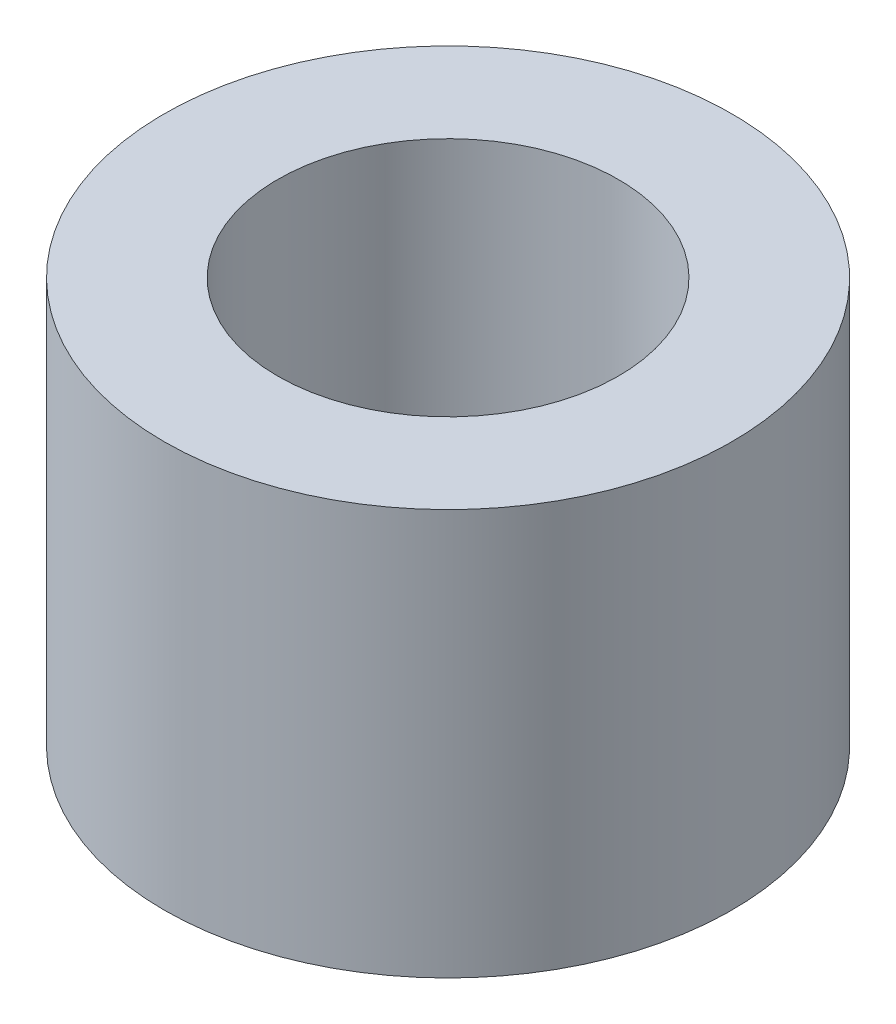
from build123d import *

# Parameters (mm, degrees)
SKETCH_1_R      = 3.5
SKETCH_1_R_2    = 2.1
EXTRUDE_1_DEPTH = 5


with BuildPart() as part:
    # 草图1 → 凸台-拉伸1 (new body)
    with BuildSketch(Plane(origin=(0, 0, 0), x_dir=(1, 0, 0), z_dir=(0, 1, 0))):
        Circle(SKETCH_1_R)
        Circle(SKETCH_1_R_2, mode=Mode.SUBTRACT)
    extrude(amount=EXTRUDE_1_DEPTH)


solid = part.part
